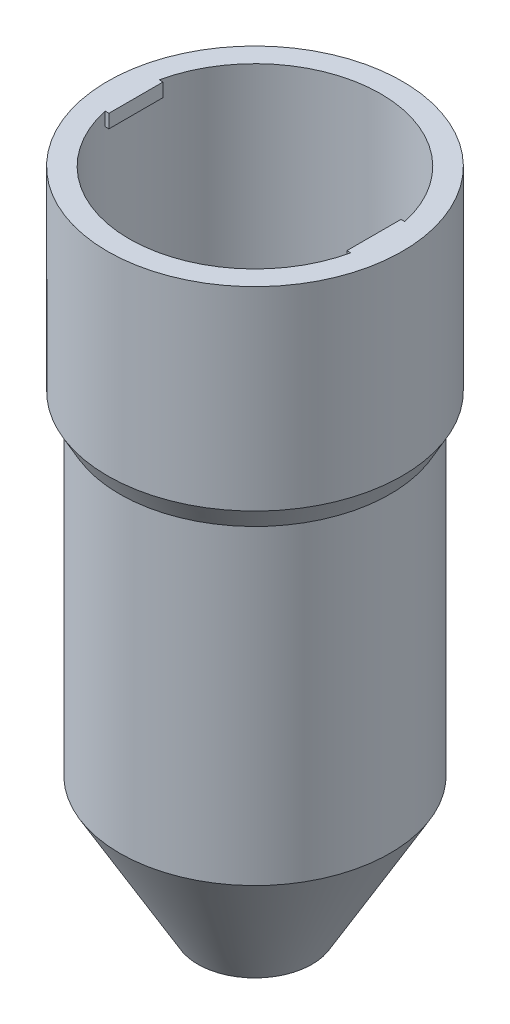
from build123d import *

# Parameters (mm, degrees)
SKETCH1_R           = 5
SKETCH1_R_2         = 2.75
BOSS_EXTRUDE1_DEPTH = 16
BOSS_EXTRUDE2_START = 1.5
SKETCH2_R           = 5
BOSS_EXTRUDE2_DEPTH = 1.5
SKETCH3_R           = 0.75
CUT_EXTRUDE1_DEPTH  = 1.5
CHAMFER1_SIZE       = 5
CHAMFER1_SIZE2      = 2.886751346
CHAMFER2_SIZE       = 2
CHAMFER2_SIZE2      = 1.154700538
FILLET1_R           = 1
SKETCH5_R           = 5.45
SKETCH5_R_2         = 4.65
BOSS_EXTRUDE4_DEPTH = 7
CHAMFER4_SIZE       = 0.554309051
CHAMFER4_SIZE_2     = 1
SKETCH6_W           = 0.5
SKETCH6_H           = 2
BOSS_EXTRUDE5_DEPTH = 0.5


with BuildPart() as part:
    # Sketch1 → Boss-Extrude1 (new body)
    with BuildSketch(Plane(origin=(0, 0, 0), x_dir=(1, 0, 0), z_dir=(0, 1, 0))):
        with Locations(Location((0, 0, 0), (0, 0, 270))):
            Circle(SKETCH1_R)
        with Locations(Location((0, 0, 0), (0, 0, 270))):
            Circle(SKETCH1_R_2, mode=Mode.SUBTRACT)
    extrude(amount=BOSS_EXTRUDE1_DEPTH)

    # Sketch2 → Boss-Extrude2 (add)
    with BuildSketch(Plane.XZ.offset(BOSS_EXTRUDE2_START)):
        with Locations(Location((0, 0, 0), (0, 0, 270))):
            Circle(SKETCH2_R)
    extrude(amount=-BOSS_EXTRUDE2_DEPTH)

    # Sketch3 → Cut-Extrude1 (cut)
    with BuildSketch(Plane(origin=(0, 0, 0), x_dir=(1, 0, 0), z_dir=(0, 1, 0))):
        with Locations(Location((0, 0, 0), (0, 0, 270))):
            Circle(SKETCH3_R)
    extrude(amount=-CUT_EXTRUDE1_DEPTH, mode=Mode.SUBTRACT)

    # Chamfer1
    chamfer1_edges = [part.edges().sort_by_distance(p)[0] for p in [
        (0, -1.5, 5),
    ]]
    chamfer1_side = [part.faces().sort_by_distance(p)[0] for p in [
        (0, -0.75, 5),
    ]]
    chamfer(chamfer1_edges, length=CHAMFER1_SIZE, length2=CHAMFER1_SIZE2, reference=chamfer1_side[0])

    # Chamfer2
    chamfer2_edges = [part.edges().sort_by_distance(p)[0] for p in [
        (0, 0, -2.75),
    ]]
    chamfer2_side = [part.faces().sort_by_distance(p)[0] for p in [
        (0, 8, -2.75),
    ]]
    chamfer(chamfer2_edges, length=CHAMFER2_SIZE, length2=CHAMFER2_SIZE2, reference=chamfer2_side[0])

    # Fillet1
    fillet1_edges = [part.edges().sort_by_distance(p)[0] for p in [
        (0, 16, -2.75),
    ]]
    fillet(fillet1_edges, radius=FILLET1_R)

    # Sketch5 → Boss-Extrude4 (add)
    with BuildSketch(Plane(origin=(0, 16, 0), x_dir=(1, 0, 0), z_dir=(0, 1, 0))):
        with Locations(Location((0, 0, 0), (0, 0, 270))):
            Circle(SKETCH5_R)
        with Locations(Location((0, 0, 0), (0, 0, 270))):
            Circle(SKETCH5_R_2, mode=Mode.SUBTRACT)
    extrude(amount=BOSS_EXTRUDE4_DEPTH)

    # Chamfer4
    # the kernel refuses this chamfer: 1, 0.554309051 mm, written as the material it adds along each edge
    with BuildSketch(Plane(origin=(0, 16, 0), x_dir=(0, 0, 1), z_dir=(-1, 0, 0))) as chamfer4_piece_1_section:
        Polygon((5 + CHAMFER4_SIZE, 0), (5, -CHAMFER4_SIZE_2), (5, 0), align=None)
    chamfer4_piece_1 = revolve(axis=Axis((0, 16, 0), (0, 1, 0)), mode=Mode.PRIVATE)
    chamfer4_piece_1 = chamfer4_piece_1 & Plane(origin=(0, 15.398774121, 0), x_dir=(0, 0, 1), z_dir=(0, -1, 0)) * Cylinder(5.45, 23, mode=Mode.PRIVATE)
    add(chamfer4_piece_1)

    # Sketch6 → Boss-Extrude5 (add)
    with BuildSketch(Plane(origin=(0, 23, 0), x_dir=(1, 0, 0), z_dir=(0, 1, 0))):
        with Locations((4.65, 0)):
            Rectangle(SKETCH6_W, SKETCH6_H)
        with Locations((-4.65, 0)):
            Rectangle(SKETCH6_W, SKETCH6_H)
    extrude(amount=-BOSS_EXTRUDE5_DEPTH)


solid = part.part
